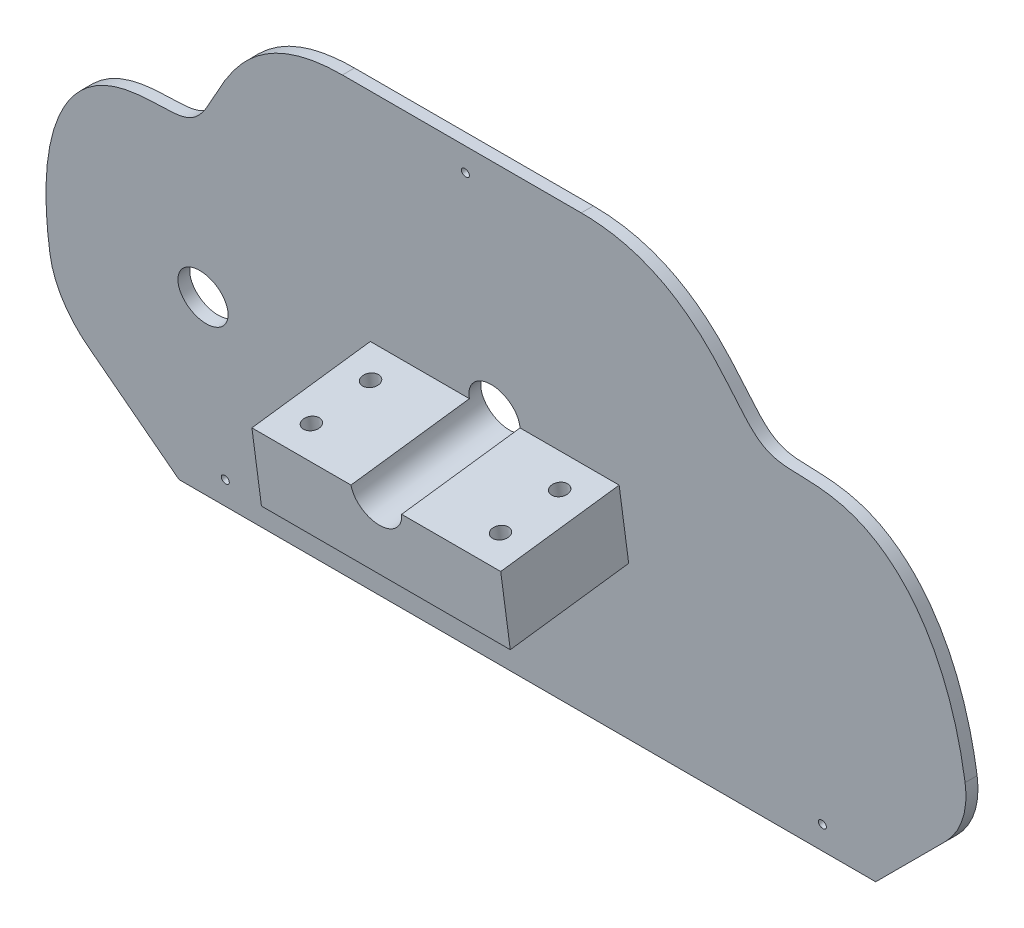
from build123d import *

# Parameters (mm, degrees)
EXTRUDE_START                                 = -25
EXTRUDE_PLATE_SHAPE_DEPTH                     = 50
CUT_EXTRUDE_ANGLE_DEPTH                       = 341.53226913
CUT_EXTRUDE_ANGLE_DEPTH_BACK                  = 341.53226913
CUT_EXTRUDE_SWITCH_HOLE_DEPTH                 = 340.963942654
CUT_EXTRUDE_SWITCH_HOLE_DEPTH_BACK            = 340.963942654
IGNITION_SWITCH_HOLE_R                        = 12.5
CUT_EXTRUDE_TOP_ENCLOSURE_HOLE_DEPTH          = 340.910991738
CUT_EXTRUDE_TOP_ENCLOSURE_HOLE_DEPTH_BACK     = 340.910991738
SKETCH23_R                                    = 2
CUT_EXTRUDE_BOTTOM_ENCLOSURE_HOLES_DEPTH      = 340.910991738
CUT_EXTRUDE_BOTTOM_ENCLOSURE_HOLES_DEPTH_BACK = 340.910991738
BOTTOM_ENCLOSURE_MOUNTING_HOLES_R             = 2
BOSS_EXTRUDE1_START                           = -6
SKETCH24_W                                    = 125
SKETCH24_H                                    = 75
BOSS_EXTRUDE1_DEPTH                           = 60
CUT_EXTRUDE_SHAFT_HOLE_DEPTH                  = 349.685760497
CUT_EXTRUDE_SHAFT_HOLE_DEPTH_BACK             = 349.685760497
STEERING_WHEEL_SHAFT_HOLE_R                   = 12.75
SKETCH26_W                                    = 456.008458956
SKETCH26_H                                    = 1.5
EXTRUDE_CUT_SLOT_DEPTH                        = 348.814796903
CUT_EXTRUDE17_DEPTH                           = 285.275916409
CUT_EXTRUDE17_DEPTH_BACK                      = 285.275916409
SKETCH28_R                                    = 4
CUT_EXTRUDE18_DEPTH                           = 351.351894744
CUT_EXTRUDE18_DEPTH_BACK                      = 60
SKETCH30_W                                    = 150
SKETCH30_H                                    = 50


# Read off the part's stored shape, not the designer's step: Extrude Plate Shape
with BuildPart() as part:
    # Extrude Plate Shape outline → Extrude Plate Shape (new body)
    with BuildSketch(Plane.XY.offset(EXTRUDE_START)):
        with BuildLine():
            Line((175, 0), (215.218833807, 40.218833807))
            ThreePointArc((215.218833807, 40.218833807), (226.057471223, 56.440000887), (229.863494748, 75.574172084))
            add(Edge.make_bspline(
                [(229.863494748, 75.574172084), (229.863497015, 220.574172084), (130.657195822, 208), (130.657198498, 108), (160, 250), (60, 250)],
                knots=[0, 0, 0, 0, 0, 0, 1, 1, 1, 1, 1, 1], degree=5))
            Line((60, 250), (-60, 250))
            add(Edge.make_bspline(
                [(-60, 250), (-160, 250), (-130.657198498, 108), (-130.657195822, 208), (-229.863497015, 220.574172084), (-229.863494748, 75.574172084)],
                knots=[0, 0, 0, 0, 0, 0, 1, 1, 1, 1, 1, 1], degree=5))
            ThreePointArc((-229.863494748, 75.574172084), (-226.057471223, 56.440000887), (-215.218833807, 40.218833807))
            Line((-215.218833807, 40.218833807), (-175, 0))
            Line((-175, 0), (175, 0))
        make_face()
    extrude(amount=EXTRUDE_PLATE_SHAPE_DEPTH)

    # 5-Degree Front Plate → Cut-Extrude Angle (cut, two sides: drawn at the far end of the back side and taken through both)
    with BuildSketch(Plane(origin=(0, 0, 0), x_dir=(0, 0, -1), z_dir=(1, 0, 0)).offset(-CUT_EXTRUDE_ANGLE_DEPTH_BACK)):
        Polygon((20.798974056, -10), (-14.747200293, 260), (35, 260), (35, -10), align=None)
        Polygon((-20.798974056, 260), (14.747200293, -10), (-35, -10), (-35, 260), align=None)
    extrude(amount=CUT_EXTRUDE_ANGLE_DEPTH + CUT_EXTRUDE_ANGLE_DEPTH_BACK, mode=Mode.SUBTRACT)

    # Ignition Switch Hole → Cut-Extrude Switch Hole (cut, two sides: drawn at the far end of the back side and taken through both)
    with BuildSketch(Plane(origin=(0, 2.521214434, -19.150524903), x_dir=(-1, 0, 0), z_dir=(0, 0.13052619222005532, -0.99144486137381)).offset(-CUT_EXTRUDE_SWITCH_HOLE_DEPTH_BACK)):
        with Locations(Location((150, 97.457030106, 0), (0, 0, 90))):
            Circle(IGNITION_SWITCH_HOLE_R)
    extrude(amount=CUT_EXTRUDE_SWITCH_HOLE_DEPTH + CUT_EXTRUDE_SWITCH_HOLE_DEPTH_BACK, mode=Mode.SUBTRACT)

    # Sketch23 → Cut-Extrude Top Enclosure Hole (cut, two sides: drawn at the far end of the back side and taken through both)
    with BuildSketch(Plane(origin=(0, 1.73805728, -13.201855735), x_dir=(1, 0, 0), z_dir=(0, -0.13052619222005535, 0.99144486137381)).offset(-CUT_EXTRUDE_TOP_ENCLOSURE_HOLE_DEPTH_BACK)):
        with Locations(Location((0, 236.854185237, 0), (0, 0, 270))):
            Circle(SKETCH23_R)
    extrude(amount=CUT_EXTRUDE_TOP_ENCLOSURE_HOLE_DEPTH + CUT_EXTRUDE_TOP_ENCLOSURE_HOLE_DEPTH_BACK, mode=Mode.SUBTRACT)

    # Bottom Enclosure Mounting Holes → Cut-Extrude Bottom Enclosure Holes (cut, two sides: drawn at the far end of the back side and taken through both)
    with BuildSketch(Plane(origin=(0, 1.73805728, -13.201855735), x_dir=(1, 0, 0), z_dir=(0, -0.13052619222005535, 0.99144486137381)).offset(-CUT_EXTRUDE_BOTTOM_ENCLOSURE_HOLES_DEPTH_BACK)):
        with Locations(Location((150, 11.746945092, 0), (0, 0, 270))):
            Circle(BOTTOM_ENCLOSURE_MOUNTING_HOLES_R)
        with Locations(Location((-150, 11.746945092, 0), (0, 0, 270))):
            Circle(BOTTOM_ENCLOSURE_MOUNTING_HOLES_R)
    extrude(amount=CUT_EXTRUDE_BOTTOM_ENCLOSURE_HOLES_DEPTH + CUT_EXTRUDE_BOTTOM_ENCLOSURE_HOLES_DEPTH_BACK, mode=Mode.SUBTRACT)

    # Sketch24 → Boss-Extrude1 (add)
    with BuildSketch(Plane(origin=(0, 2.521214434, -19.150524903), x_dir=(-1, 0, 0), z_dir=(0, 0.13052619222005538, -0.99144486137381)).offset(BOSS_EXTRUDE1_START)):
        with Locations((0, 124.614270251)):
            Rectangle(SKETCH24_W, SKETCH24_H)
    extrude(amount=-BOSS_EXTRUDE1_DEPTH)

    # Steering Wheel Shaft Hole → Cut-Extrude Shaft Hole (cut, two sides: drawn at the far end of the back side and taken through both)
    with BuildSketch(Plane(origin=(0, 2.521214434, -19.150524903), x_dir=(-1, 0, 0), z_dir=(0, 0.13052619222005532, -0.99144486137381)).offset(-CUT_EXTRUDE_SHAFT_HOLE_DEPTH_BACK)):
        with Locations(Location((0, 124.614270251, 0), (0, 0, 90))):
            Circle(STEERING_WHEEL_SHAFT_HOLE_R)
    extrude(amount=CUT_EXTRUDE_SHAFT_HOLE_DEPTH + CUT_EXTRUDE_SHAFT_HOLE_DEPTH_BACK, mode=Mode.SUBTRACT)

    # Sketch26 → Extrude-Cut Slot (cut, through all)
    with BuildSketch(Plane(origin=(0, 1.73805728, -13.201855735), x_dir=(1, 0, 0), z_dir=(0, -0.13052619222005535, 0.99144486137381))):
        with Locations((0, 124.614270251)):
            Rectangle(SKETCH26_W, SKETCH26_H)
    extrude(amount=EXTRUDE_CUT_SLOT_DEPTH, mode=Mode.SUBTRACT)

    # Sketch28 → Cut-Extrude17 (cut, two sides: drawn at the far end of the back side and taken through both)
    with BuildSketch(Plane(origin=(0, 160.727360196, 21.1601584), x_dir=(1, 0, 0), z_dir=(0, 0.99144486137381, 0.1305261922200554)).offset(-CUT_EXTRUDE17_DEPTH_BACK)):
        with Locations(Location((-47.5, -31.684225972, 0), (0, 0, 270))):
            Circle(SKETCH28_R)
        with Locations(Location((-47.5, -1.684225972, 0), (0, 0, 270))):
            Circle(SKETCH28_R)
        with Locations(Location((47.5, -31.684225972, 0), (0, 0, 90))):
            Circle(SKETCH28_R)
        with Locations(Location((47.5, -1.684225972, 0), (0, 0, 90))):
            Circle(SKETCH28_R)
    extrude(amount=CUT_EXTRUDE17_DEPTH + CUT_EXTRUDE17_DEPTH_BACK, mode=Mode.SUBTRACT)

    # Sketch30 → Cut-Extrude18 (cut, two sides: drawn at the far end of the back side and taken through both)
    with BuildSketch(Plane(origin=(0, -6.093514253, 46.284835948), x_dir=(1, 0, 0), z_dir=(0, -0.1305261922200554, 0.99144486137381)).offset(-CUT_EXTRUDE18_DEPTH_BACK)):
        with Locations((0, 149.614270251)):
            Rectangle(SKETCH30_W, SKETCH30_H)
    extrude(amount=CUT_EXTRUDE18_DEPTH + CUT_EXTRUDE18_DEPTH_BACK, mode=Mode.SUBTRACT)


solid = part.part
